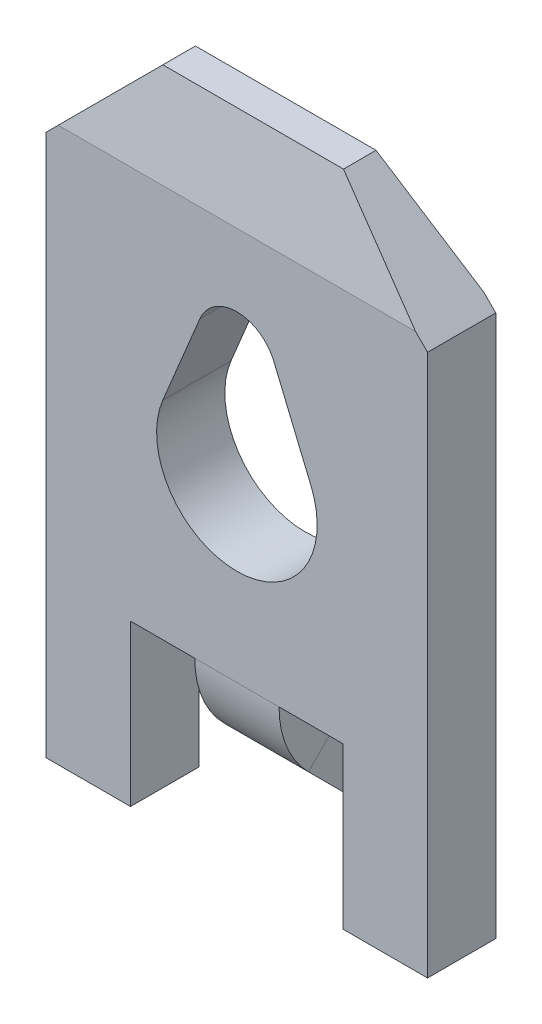
from build123d import *

# Parameters (mm, degrees)
BOSS_EXTRUDE1_DEPTH    = 4.75
CUT_EXTRUDE1_REACH     = 11.471
CUT_EXTRUDE2_DEPTH     = 0.85
SKETCH6_W              = 0.8
SKETCH6_H              = 2
CUT_EXTRUDE3_DEPTH     = 0.85
SKETCH7_W              = 1.05
SKETCH7_H              = 0.85
BOSS_EXTRUDE2_DEPTH    = 1
SKETCHED_START         = 1.85
SKETCHED_BEND1_DEPTH   = 1.05
SKETCHED_BEND1_2_DEPTH = 1.05


# Read off the part's stored shape, not the designer's step: Sketched Bend1
with BuildPart() as part:
    # Sketch1 → Boss-Extrude1 (new body)
    with BuildSketch(Plane(origin=(0, 0, 0), x_dir=(0, 0, -1), z_dir=(1, 0, 0))):
        Polygon((0, 0.15), (0, 7.05), (-0.241393443, 8.15), (-0.647131148, 8.15), (-0.85, 7.05), (-0.85, 0.15), align=None)
    extrude(amount=BOSS_EXTRUDE1_DEPTH)

    # Cut-Extrude1: up to this face of the body (flat: up to its plane)
    cut_extrude1_end = Plane(part.part.faces().sort_by_distance((2.375, 3.6, 0))[0])
    # Sketch4 → Cut-Extrude1 (cut, up to the picked face)
    with BuildSketch(Plane.XY.offset(0.85), mode=Mode.PRIVATE) as cut_extrude1_sk1:
        Polygon((0, 6.9), (1.25, 8.15), (0, 8.15), align=None)
    cut_extrude1_tool1 = split(extrude(cut_extrude1_sk1.sketch, amount=-CUT_EXTRUDE1_REACH, mode=Mode.PRIVATE), bisect_by=cut_extrude1_end, keep=Keep.BOTH, mode=Mode.PRIVATE)
    # Sketch4 → Cut-Extrude1 (cut, up to the picked face)
    with BuildSketch(Plane.XY.offset(0.85), mode=Mode.PRIVATE) as cut_extrude1_sk2:
        Polygon((3.5, 8.15), (4.75, 6.9), (4.75, 8.15), align=None)
    cut_extrude1_tool2 = split(extrude(cut_extrude1_sk2.sketch, amount=-CUT_EXTRUDE1_REACH, mode=Mode.PRIVATE), bisect_by=cut_extrude1_end, keep=Keep.BOTH, mode=Mode.PRIVATE)
    add(cut_extrude1_tool1.solids().sort_by(Axis((0.416667, 7.733333, 0.85), (0, 0, -1)))[0], mode=Mode.SUBTRACT)
    add(cut_extrude1_tool2.solids().sort_by(Axis((4.333333, 7.733333, 0.85), (0, 0, -1)))[0], mode=Mode.SUBTRACT)

    # Sketch5 → Cut-Extrude2 (cut)
    with BuildSketch(Plane.XY.offset(0.85)):
        with BuildLine():
            Line((1.913461538, 5.842307692), (1.451923077, 4.734615385))
            ThreePointArc((1.451923077, 4.734615385), (2.37510742, 3.350000006), (3.297994271, 4.734813689))
            Line((3.297994271, 4.734813689), (2.842436975, 5.827489929))
            ThreePointArc((2.842436975, 5.827489929), (2.382974312, 6.149936406), (1.913461538, 5.842307692))
        make_face()
    extrude(amount=-CUT_EXTRUDE2_DEPTH, mode=Mode.SUBTRACT)

    # Sketch6 → Cut-Extrude3 (cut)
    with BuildSketch(Plane(origin=(0, 0, 0), x_dir=(-1, 0, 0), z_dir=(0, 0, -1))):
        with Locations((-3.3, 1.15)):
            Rectangle(SKETCH6_W, SKETCH6_H)
        with Locations((-1.45, 1.15)):
            Rectangle(SKETCH6_W, SKETCH6_H)
    extrude(amount=-CUT_EXTRUDE3_DEPTH, mode=Mode.SUBTRACT)

    # Sketch7 → Boss-Extrude2 (add)
    with BuildSketch(Plane.XZ.offset(-0.15)):
        with Locations((2.375, 0.425)):
            Rectangle(SKETCH7_W, SKETCH7_H)
    extrude(amount=BOSS_EXTRUDE2_DEPTH)

    # Sketched Bend1 outline → Sketched Bend1 (cut)
    with BuildSketch(Plane.YZ.offset(SKETCHED_START)):
        with BuildLine():
            ThreePointArc((1.266116524, 0.483883476), (1.67164571, 0.754849416), (2.15, 0.85))
            Line((2.15, 0.85), (-0.85, 0.85))
            Line((-0.85, 0.85), (-0.85, 0))
            Line((-0.85, 0), (0.782233048, 0))
            Line((0.782233048, 0), (1.266116524, 0.483883476))
        make_face()
    extrude(amount=SKETCHED_BEND1_DEPTH, mode=Mode.SUBTRACT)

    # Sketched Bend1 2 outline → Sketched Bend1 2 (add)
    with BuildSketch(Plane.YZ.offset(SKETCHED_START)):
        with BuildLine():
            Line((2.15, 0), (0.782233048, 0))
            Line((0.782233048, 0), (-0.397031517, -1.179264564))
            Line((-0.397031517, -1.179264564), (0.204009247, -1.780305328))
            Line((0.204009247, -1.780305328), (1.867157288, -0.117157288))
            ThreePointArc((1.867157288, -0.117157288), (1.996926627, -0.030448187), (2.15, 0))
        make_face()
    extrude(amount=SKETCHED_BEND1_2_DEPTH)


solid = part.part
